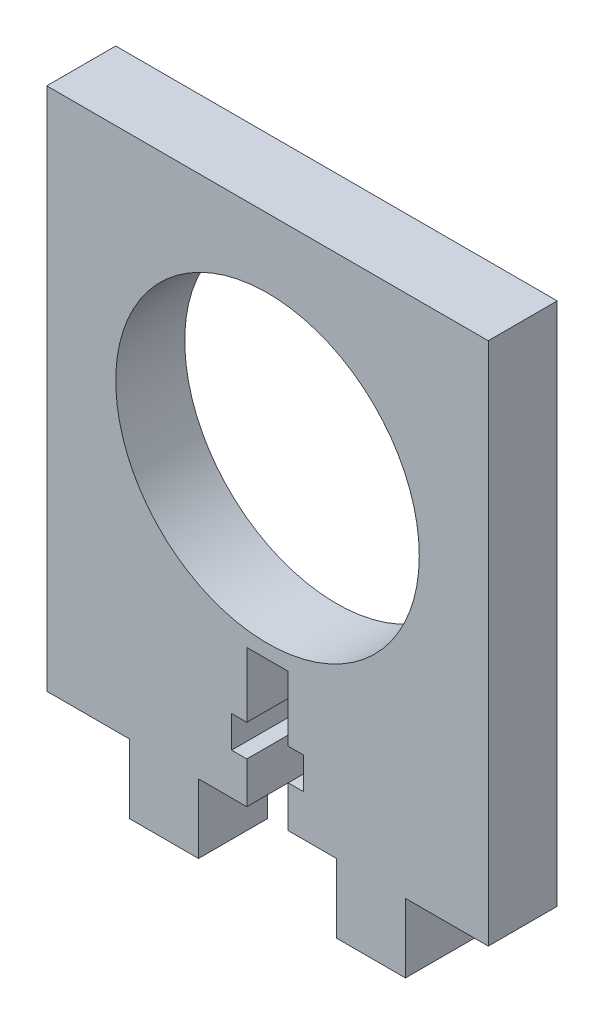
from build123d import *

# Parameters (mm, degrees)
SKETCH1_R           = 11
BOSS_EXTRUDE1_DEPTH = 5


with BuildPart() as part:
    # Sketch1 → Boss-Extrude1 (new body)
    with BuildSketch(Plane.XY):
        Polygon((-16, 16), (-16, -22), (-10, -22), (-10, -27), (-5, -27), (-5, -22), (-1.5, -22), (-1.5, -19), (-2.6, -19), (-2.6, -16.7), (-1.5, -16.7), (-1.5, -12), (1.5, -12), (1.5, -16.7), (2.6, -16.7), (2.6, -19), (1.5, -19), (1.5, -22), (5, -22), (5, -27), (10, -27), (10, -22), (16, -22), (16, 16), align=None)
        Circle(SKETCH1_R, mode=Mode.SUBTRACT)
    extrude(amount=BOSS_EXTRUDE1_DEPTH)


solid = part.part
